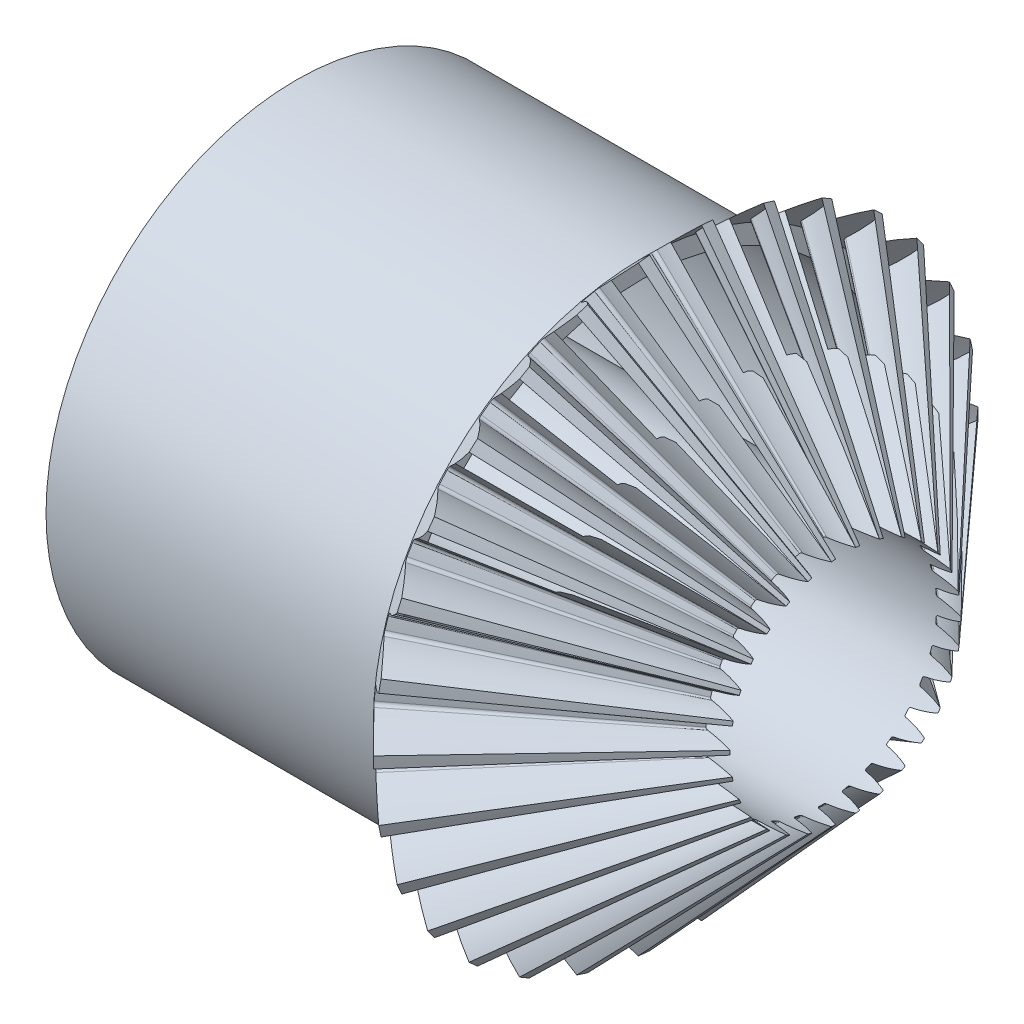
from build123d import *

# Parameters (mm, degrees)
TEETHCUTS_COUNT = 30
TEETHCUTS_ANGLE = 348
HUBSKE_R        = 6.5
HUB_DEPTH       = 8.974190931
BORSKE_R        = 3
BORE_DEPTH      = 17.0000508


with BuildPart() as part:
    # BasProSke → Base-Revolve (revolve)
    with BuildSketch(Plane(origin=(0, 0, 0), x_dir=(1, 0, 0), z_dir=(0, 1, 0)), mode=Mode.PRIVATE) as base_revolve_sk:
        Polygon((0, 0), (0, 6.974089332), (0.87946406, 7.85355339), (7.311266002, 0.785355333), (7.223319596, 0.697408928), (7.223319596, 0), align=None)
    revolve(base_revolve_sk.sketch.rotate(Axis((-10, 0, 0), (1, 0, 0)), 180), axis=Axis((-10, 0, 0), (1, 0, 0)))

    # ToothCut: read off the stored shape, not the designer's step
    # ToothCut: loft between two sections, ruled curve by curve
    toothcut_from = [
        Edge.make_bspline([(8.03228423, 0.006373561, -0.008946802), (8.027929574, 0.002018905, -0.015151186), (8.021779746, -0.004130923, -0.014268199), (8.018395676, -0.007514993, -0.006952695)], [0, 0, 0, 0, 1, 1, 1, 1], 3, [1, 0.75278817, 0.75278817, 1]),
        Edge.make_bspline([(8.018395676, -0.007514993, 0.006952695), (8.021779746, -0.004130923, 0.014268199), (8.027929574, 0.002018905, 0.015151186), (8.03228423, 0.006373561, 0.008946802)], [0, 0, 0, 0, 1, 1, 1, 1], 3, [1, 0.75278817, 0.75278817, 1]),
        Edge.make_bspline([(8.018395676, -0.007514993, -0.006952695), (8.017963339, -0.00794733, -0.00601809), (8.017621408, -0.008289261, -0.00501137), (8.01737579, -0.008534879, -0.003949927)], [0, 0, 0, 0, 1, 1, 1, 1], 3, [1, 0.994241693, 0.994241693, 1]),
        Edge.make_bspline([(8.01737579, -0.008534879, 0.003949927), (8.017621408, -0.008289261, 0.00501137), (8.017963339, -0.00794733, 0.00601809), (8.018395676, -0.007514993, 0.006952695)], [0, 0, 0, 0, 1, 1, 1, 1], 3, [1, 0.994241693, 0.994241693, 1]),
        Edge.make_bspline([(8.01737579, -0.008534879, -0.003949927), (8.016776868, -0.009133801, -0.001361664), (8.016776868, -0.009133801, 0.001361664), (8.01737579, -0.008534879, 0.003949927)], [0, 0, 0, 0, 1, 1, 1, 1], 3, [1, 0.966936049, 0.966936049, 1]),
        Edge.make_line((8.03228423, 0.006373561, 0.008946802), (8.03228423, 0.006373561, -0.008946802)),
    ]
    toothcut_to = [
        Edge.make_bspline([(0.966358467, 7.940447797, -0.777369118), (0.725630792, 7.699720123, -0.516835409), (0.451434767, 7.425524099, -0.334049959), (0.156131696, 7.130221027, -0.237253099)], [0, 0, 0, 0, 1, 1, 1, 1], 3, [1, 0.98497267, 0.98497267, 1]),
        Edge.make_bspline([(0.156131696, 7.130221027, 0.237253099), (0.451434767, 7.425524099, 0.334049959), (0.725630792, 7.699720123, 0.516835409), (0.966358467, 7.940447797, 0.777369118)], [0, 0, 0, 0, 1, 1, 1, 1], 3, [1, 0.98497267, 0.98497267, 1]),
        Edge.make_bspline([(0.156131696, 7.130221027, -0.237253099), (0.123820033, 7.097909365, -0.226661718), (0.103453082, 7.077542414, -0.189639577), (0.104138748, 7.078228079, -0.142742625)], [0, 0, 0, 0, 1, 1, 1, 1], 3, [1, 0.850936506, 0.850936506, 1]),
        Edge.make_bspline([(0.104138748, 7.078228079, 0.142742625), (0.103453082, 7.077542414, 0.189639577), (0.123820033, 7.097909365, 0.226661718), (0.156131696, 7.130221027, 0.237253099)], [0, 0, 0, 0, 1, 1, 1, 1], 3, [1, 0.850936506, 0.850936506, 1]),
        Edge.make_bspline([(0.104138748, 7.078228079, -0.142742625), (0.105529979, 7.079619311, -0.047587655), (0.105529979, 7.079619311, 0.047587655), (0.104138748, 7.078228079, 0.142742625)], [0, 0, 0, 0, 1, 1, 1, 1], 3, [1, 0.999857536, 0.999857536, 1]),
        Edge.make_line((0.966358467, 7.940447797, 0.777369118), (0.966358467, 7.940447797, -0.777369118)),
    ]
    toothcut = Solid(Shell([*[Face.make_surface_from_curves(toothcut_from[k], toothcut_to[k]) for k in range(6)], Face(Wire(toothcut_from)), Face(Wire(toothcut_to))]))
    add(toothcut, mode=Mode.SUBTRACT)

    # TeethCuts: ToothCut ×30 about axis
    teethcuts_axis = Axis((-10, 0, 0), (1, 0, 0))
    for i in range(1, TEETHCUTS_COUNT):
        add(toothcut.rotate(teethcuts_axis, i * TEETHCUTS_ANGLE / (TEETHCUTS_COUNT - 1)), mode=Mode.SUBTRACT)

    # HubSke → Hub (add)
    with BuildSketch(Plane.ZY):
        with Locations(Location((0, 0, 0), (0, 0, 180))):
            Circle(HUBSKE_R)
    extrude(amount=HUB_DEPTH)

    # BorSke → Bore (cut, symmetric)
    with BuildSketch(Plane(origin=(0, 0, 0), x_dir=(0, 0, -1), z_dir=(1, 0, 0))):
        with Locations(Location((0, 0, 0), (0, 0, 180))):
            Circle(BORSKE_R)
    extrude(amount=BORE_DEPTH, both=True, mode=Mode.SUBTRACT)


solid = part.part
